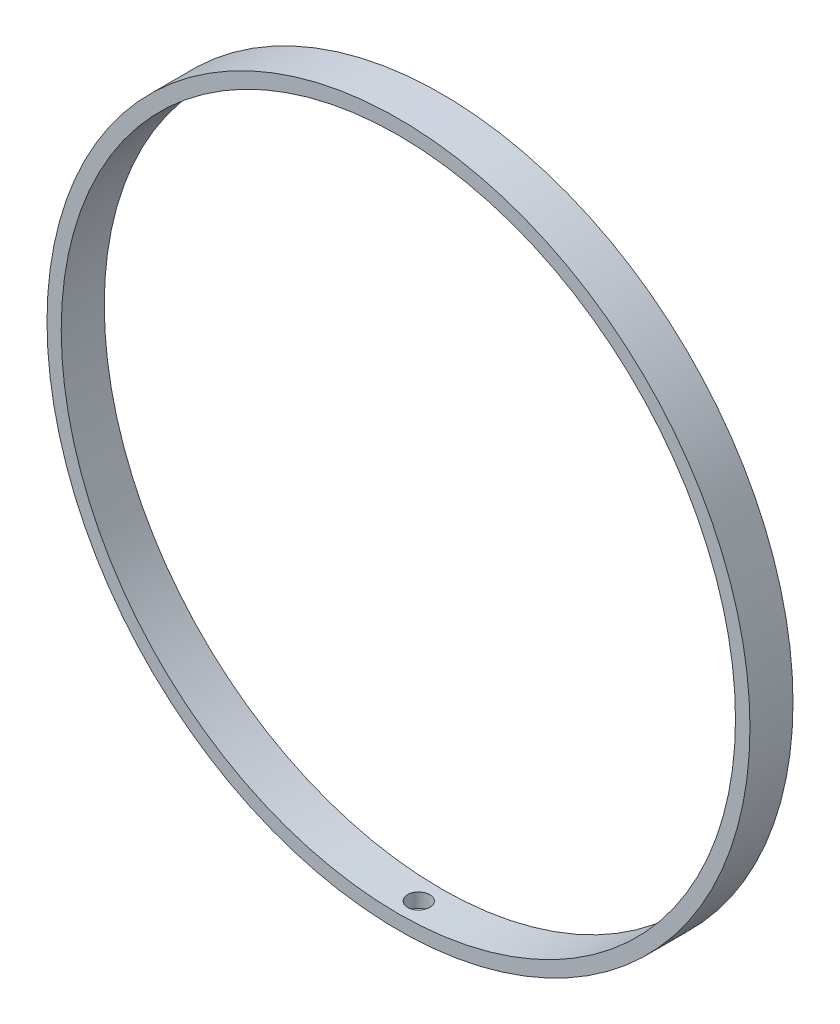
from build123d import *

# Parameters (mm, degrees)
ESQUISSE1_R             = 122.5
BOSS_EXTRU_1_DEPTH      = 15
ESQUISSE3D1_R           = 117.5
ENL_V_MAT_EXTRU_1_DEPTH = 21
ESQUISSE2_R             = 3.85
ENL_V_MAT_EXTRU_2_DEPTH = 217.77873659


with BuildPart() as part:
    # Esquisse1 → Boss.-Extru.1 (new body)
    with BuildSketch(Plane.XY):
        with Locations((-41.00744319, 19.039170053)):
            Circle(ESQUISSE1_R)
    extrude(amount=BOSS_EXTRU_1_DEPTH)

    # Esquisse3D1 → Enlèv. mat.-Extru.1 (cut)
    with BuildSketch(Plane(origin=(-41.053541595, 19.002849863, 0), x_dir=(1, 0, 0), z_dir=(0, 0, 1))):
        Circle(ESQUISSE3D1_R)
    extrude(amount=ENL_V_MAT_EXTRU_1_DEPTH, mode=Mode.SUBTRACT)

    # Esquisse2 → Enlèv. mat.-Extru.2 (cut, through all)
    with BuildSketch(Plane(origin=(0, 0, 0), x_dir=(1, 0, 0), z_dir=(0, 1, 0))):
        with Locations((-41.310397507, -7.625301321)):
            Circle(ESQUISSE2_R)
    extrude(amount=-ENL_V_MAT_EXTRU_2_DEPTH, mode=Mode.SUBTRACT)


solid = part.part
